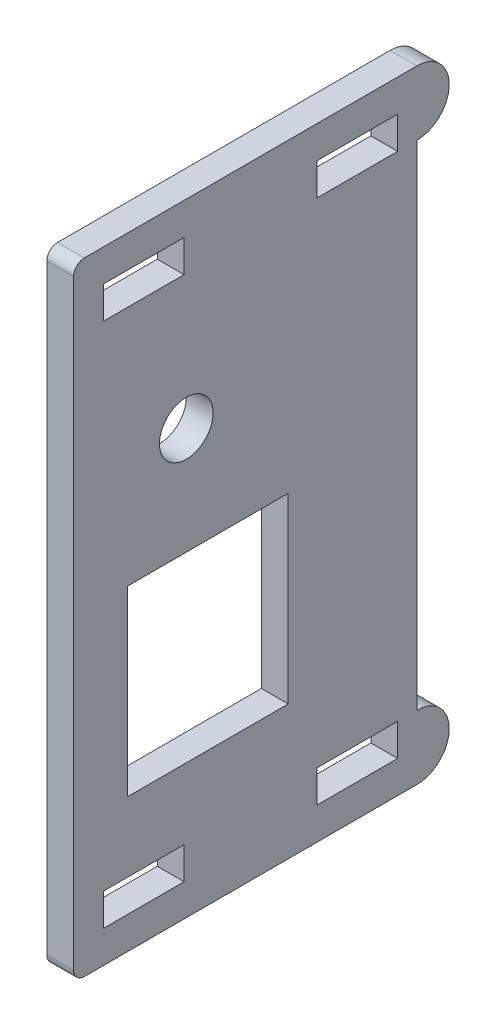
from build123d import *

# Parameters (mm, degrees)
SKETCH_2_W          = 35
SKETCH_2_H          = 58
EXTRUDE_1_DEPTH     = 2.5
SKETCH_4_W          = 7.5
SKETCH_4_H          = 3
CUT_EXTRUDE_1_DEPTH = 34.963215395
CUT_EXTRUDE_2_DEPTH = 34.963215395
SKETCH_7_R          = 2.5
SKETCH_7_W          = 15
SKETCH_7_H          = 17
CUT_EXTRUDE_3_DEPTH = 34.963215395
FILLET_1_R          = 1


with BuildPart() as part:
    # 草图2 → 凸台-拉伸1 (new body)
    with BuildSketch(Plane(origin=(0, 0, 0), x_dir=(0, 0, -1), z_dir=(1, 0, 0))):
        Rectangle(SKETCH_2_W, SKETCH_2_H)
    extrude(amount=EXTRUDE_1_DEPTH)

    # 草图4 → 切除-拉伸1 (cut, through all)
    with BuildSketch(Plane.ZY):
        with Locations((-8.95, 24.5)):
            Rectangle(SKETCH_4_W, SKETCH_4_H)
        with Locations((10.95, 24.5)):
            Rectangle(SKETCH_4_W, SKETCH_4_H)
        with Locations((-8.95, -24.5)):
            Rectangle(SKETCH_4_W, SKETCH_4_H)
        with Locations((10.95, -24.5)):
            Rectangle(SKETCH_4_W, SKETCH_4_H)
    extrude(amount=-CUT_EXTRUDE_1_DEPTH, mode=Mode.SUBTRACT)

    # 草图5 → 切除-拉伸2 (cut, through all)
    with BuildSketch(Plane.ZY):
        with BuildLine():
            ThreePointArc((-14.5, -29), (-16.621320344, -28.121320344), (-17.5, -26))
            Line((-17.5, -26), (-17.5, -29))
            Line((-17.5, -29), (-14.5, -29))
        make_face()
        with BuildLine():
            Line((-17.5, 29), (-17.5, 26.000000007))
            ThreePointArc((-17.5, 26.000000007), (-16.621320341, 28.121320346), (-14.5, 29))
            Line((-14.5, 29), (-17.5, 29))
        make_face()
        with BuildLine():
            ThreePointArc((-14.5, 23), (-16.621320346, 23.878679659), (-17.5, 26.000000007))
            Line((-17.5, 26.000000007), (-17.5, -26))
            ThreePointArc((-17.5, -26), (-16.621320344, -23.878679656), (-14.5, -23))
            Line((-14.5, -23), (-14.5, 23))
        make_face()
    extrude(amount=-CUT_EXTRUDE_2_DEPTH, mode=Mode.SUBTRACT)

    # 草图7 → 切除-拉伸3 (cut, through all)
    with BuildSketch(Plane.ZY):
        with Locations((7, 10.5)):
            Circle(SKETCH_7_R)
        with Locations((5, -8)):
            Rectangle(SKETCH_7_W, SKETCH_7_H)
    extrude(amount=-CUT_EXTRUDE_3_DEPTH, mode=Mode.SUBTRACT)

    # 圆角1
    fillet_1_edges = [part.edges().sort_by_distance(p)[0] for p in [
        (1.25, -29, 17.5),
        (1.25, 29, 17.5),
    ]]
    fillet(fillet_1_edges, radius=FILLET_1_R)


solid = part.part
